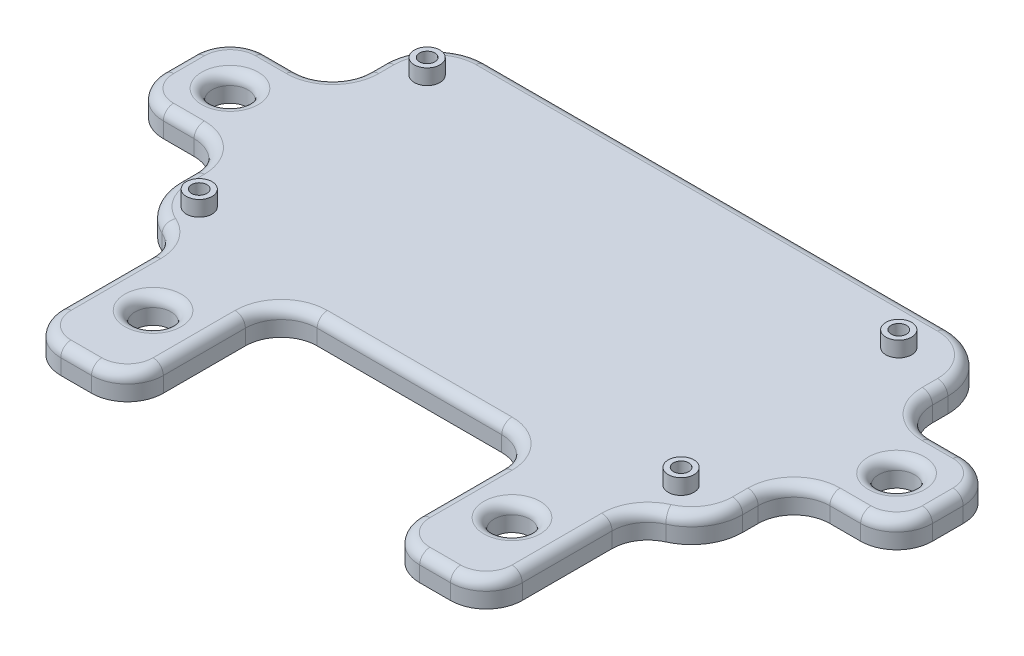
from build123d import *

# Parameters (mm, degrees)
SKETCH1_W                = 110
SKETCH1_H                = 60
BOSS_EXTRUDE1_DEPTH      = 5
SKETCH2_R                = 1.0922
CUT_EXTRUDE1_DEPTH       = 10
SKETCH3_R                = 2.5
BOSS_EXTRUDE2_DEPTH      = 3
SKETCH4_R                = 1.5
CUT_EXTRUDE2_DEPTH       = 3
BOSS_EXTRUDE3_DEPTH      = 20
BOSS_EXTRUDE3_DEPTH_BACK = 130
SKETCH5_W                = 20
SKETCH5_H                = 5
SKETCH6_R                = 3.5
CUT_EXTRUDE3_DEPTH       = 20
SKETCH7_W                = 20
SKETCH7_H                = 5
BOSS_EXTRUDE4_DEPTH      = 30
SKETCH8_R                = 3.5
CUT_EXTRUDE4_DEPTH       = 30
FILLET1_R                = 10
FILLET2_R                = 7
FILLET3_R                = 7
FILLET4_R                = 2
FILLET5_R                = 2
FILLET6_R                = 2


with BuildPart() as part:
    # Sketch1 → Boss-Extrude1 (new body)
    with BuildSketch(Plane(origin=(0, 0, 0), x_dir=(1, 0, 0), z_dir=(0, 1, 0))):
        with Locations((5.570029996, 10.074503483)):
            Rectangle(SKETCH1_W, SKETCH1_H)
    extrude(amount=BOSS_EXTRUDE1_DEPTH)

    # Sketch2 → Cut-Extrude1 (cut)
    with BuildSketch(Plane(origin=(0, 5, 0), x_dir=(1, 0, 0), z_dir=(0, 1, 0))):
        with Locations(Location((-42.429970004, 31.524503483, 0), (0, 0, 270))):
            Circle(SKETCH2_R)
        with Locations(Location((-42.429970004, -12.925496517, 0), (0, 0, 270))):
            Circle(SKETCH2_R)
        with Locations(Location((51.550029996, -12.925496517, 0), (0, 0, 270))):
            Circle(SKETCH2_R)
        with Locations(Location((49.550029996, 31.524503483, 0), (0, 0, 270))):
            Circle(SKETCH2_R)
    extrude(amount=-CUT_EXTRUDE1_DEPTH, mode=Mode.SUBTRACT)

    # Sketch3 → Boss-Extrude2 (add)
    with BuildSketch(Plane(origin=(0, 5, 0), x_dir=(1, 0, 0), z_dir=(0, 1, 0))):
        with Locations(Location((-42.429970004, 31.524503483, 0), (0, 0, 270))):
            Circle(SKETCH3_R)
        with Locations(Location((-42.429970004, -12.925496517, 0), (0, 0, 270))):
            Circle(SKETCH3_R)
        with Locations(Location((51.550029996, -12.925496517, 0), (0, 0, 270))):
            Circle(SKETCH3_R)
        with Locations(Location((49.550029996, 31.524503483, 0), (0, 0, 270))):
            Circle(SKETCH3_R)
    extrude(amount=BOSS_EXTRUDE2_DEPTH)

    # Sketch4 → Cut-Extrude2 (cut)
    with BuildSketch(Plane(origin=(0, 8, 0), x_dir=(1, 0, 0), z_dir=(0, 1, 0))):
        with Locations(Location((-42.429970004, 31.524503483, 0), (0, 0, 270))):
            Circle(SKETCH4_R)
        with Locations(Location((49.550029996, 31.524503483, 0), (0, 0, 270))):
            Circle(SKETCH4_R)
        with Locations(Location((51.550029996, -12.925496517, 0), (0, 0, 270))):
            Circle(SKETCH4_R)
        with Locations(Location((-42.429970004, -12.925496517, 0), (0, 0, 270))):
            Circle(SKETCH4_R)
    extrude(amount=-CUT_EXTRUDE2_DEPTH, mode=Mode.SUBTRACT)

    # Sketch5 → Boss-Extrude3 (add, two sides: drawn at the far end of the back side and taken through both)
    with BuildSketch(Plane(origin=(60.570029996, 0, 0), x_dir=(0, 0, -1), z_dir=(1, 0, 0)).offset(-BOSS_EXTRUDE3_DEPTH_BACK)):
        with Locations((10.074503483, 2.5)):
            Rectangle(SKETCH5_W, SKETCH5_H)
    extrude(amount=BOSS_EXTRUDE3_DEPTH + BOSS_EXTRUDE3_DEPTH_BACK)

    # Sketch6 → Cut-Extrude3 (cut)
    with BuildSketch(Plane(origin=(0, 5, 0), x_dir=(1, 0, 0), z_dir=(0, 1, 0))):
        with Locations(Location((-59.429970004, 10.074503483, 0), (0, 0, 270))):
            Circle(SKETCH6_R)
        with Locations(Location((70.570029996, 10.074503483, 0), (0, 0, 270))):
            Circle(SKETCH6_R)
    extrude(amount=-CUT_EXTRUDE3_DEPTH, mode=Mode.SUBTRACT)

    # Sketch7 → Boss-Extrude4 (add)
    with BuildSketch(Plane.XY.offset(19.925496517)):
        with Locations((-29.429970004, 2.5)):
            Rectangle(SKETCH7_W, SKETCH7_H)
        with Locations((40.570029996, 2.5)):
            Rectangle(SKETCH7_W, SKETCH7_H)
    extrude(amount=BOSS_EXTRUDE4_DEPTH)

    # Sketch8 → Cut-Extrude4 (cut)
    with BuildSketch(Plane(origin=(0, 5, 0), x_dir=(1, 0, 0), z_dir=(0, 1, 0))):
        with Locations(Location((-29.429970004, -34.925496517, 0), (0, 0, 270))):
            Circle(SKETCH8_R)
        with Locations(Location((40.570029996, -34.925496517, 0), (0, 0, 270))):
            Circle(SKETCH8_R)
    extrude(amount=-CUT_EXTRUDE4_DEPTH, mode=Mode.SUBTRACT)

    # Fillet1
    fillet1_edges = [part.edges().sort_by_distance(p)[0] for p in [
        (-49.429970004, 2.5, 19.925496517),
        (-49.429970004, 2.5, -40.074503483),
        (60.570029996, 2.5, -40.074503483),
        (60.570029996, 2.5, 19.925496517),
    ]]
    fillet(fillet1_edges, radius=FILLET1_R - 0.0001)  # a hair under: the kernel refuses the full size

    # Fillet2
    fillet2_edges = [part.edges().sort_by_distance(p)[0] for p in [
        (-69.429970004, 2.5, -20.074503483),
        (-69.429970004, 2.5, -0.074503483),
        (-49.429970004, 2.5, -20.074503483),
        (60.570029996, 2.5, -20.074503483),
        (-49.429970004, 2.5, -0.074503483),
        (60.570029996, 2.5, -0.074503483),
        (80.570029996, 2.5, -20.074503483),
        (80.570029996, 2.5, -0.074503483),
    ]]
    fillet(fillet2_edges, radius=FILLET2_R)

    # Fillet3
    fillet3_edges = [part.edges().sort_by_distance(p)[0] for p in [
        (30.570029996, 2.5, 19.925496517),
        (50.570029996, 2.5, 19.925496517),
        (50.570029996, 2.5, 49.925496517),
        (30.570029996, 2.5, 49.925496517),
        (-19.429970004, 2.5, 49.925496517),
        (-19.429970004, 2.5, 19.925496517),
        (-39.429970004, 2.5, 19.925496517),
        (-39.429970004, 2.5, 49.925496517),
    ]]
    fillet(fillet3_edges, radius=FILLET3_R)

    # Fillet4
    fillet4_edges = [part.edges().sort_by_distance(p)[0] for p in [
        (60.570029996, 5, 8.425546517),
        (5.570029996, 5, -40.074503483),
        (-49.429970004, 5, -28.574553483),
        (57.641127097, 5, -37.145600584),
        (-46.501067106, 5, -37.145600584),
        (-47.831656196, 5, 15.348819681),
        (60.570029996, 5, -28.574553483),
        (70.570029996, 5, -20.074503483),
        (70.570029996, 5, -0.074503483),
        (-49.429970004, 5, 8.425546517),
        (-59.429970004, 5, -0.074503483),
        (-59.429970004, 5, -20.074503483),
        (80.570029996, 5, -10.074503483),
        (-69.429970004, 5, -10.074503483),
        (78.519777464, 5, -2.124756015),
        (78.519777464, 5, -18.024250951),
        (-67.379717473, 5, -2.124756015),
        (-67.379717473, 5, -18.024250951),
        (62.620282527, 5, -22.124756015),
        (62.620282527, 5, 1.975749049),
        (-51.480222536, 5, 1.975749049),
        (-51.480222536, 5, -22.124756015),
        (30.570029996, 5, 34.925496517),
        (5.570029996, 5, 19.925496517),
        (50.570029996, 5, 34.171480935),
        (58.971716187, 5, 15.348819681),
        (40.570029996, 5, 49.925496517),
        (-39.429970004, 5, 34.171480935),
        (-29.429970004, 5, 49.925496517),
        (-19.429970004, 5, 34.925496517),
        (-37.379717473, 5, 47.875243985),
        (-21.480222536, 5, 47.875243985),
        (32.620282527, 5, 47.875243985),
        (48.519777464, 5, 47.875243985),
        (28.519777464, 5, 21.975749049),
        (51.68886085, 5, 21.621171175),
        (-17.379717473, 5, 21.975749049),
        (-40.548800859, 5, 21.621171175),
    ]]
    fillet(fillet4_edges, radius=FILLET4_R)

    # Fillet5
    fillet5_edges = [part.edges().sort_by_distance(p)[0] for p in [
        (-59.429970004, 5, -13.574503483),
        (70.570029996, 5, -13.574503483),
    ]]
    fillet(fillet5_edges, radius=FILLET5_R)

    # Fillet6
    fillet6_edges = [part.edges().sort_by_distance(p)[0] for p in [
        (-29.429970004, 5, 31.425496517),
        (40.570029996, 5, 31.425496517),
    ]]
    fillet(fillet6_edges, radius=FILLET6_R)


solid = part.part
